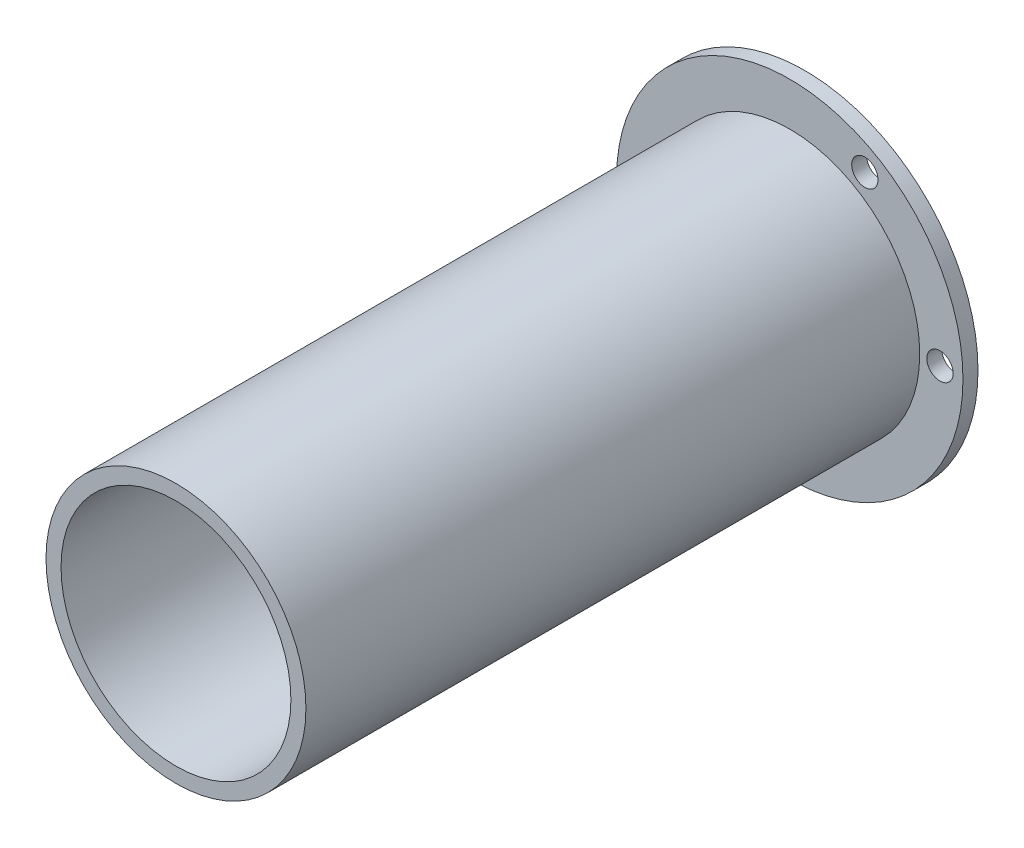
from build123d import *
from build123d.topology import SkipClean

# Parameters (mm, degrees)
SKETCH1_R           = 8.65
SKETCH1_R_2         = 7.65
BOSS_EXTRUDE1_DEPTH = 40.85
BOSS_EXTRUDE2_START = 1
SKETCH2_R           = 11.53
SKETCH2_R_2         = 7.65
BOSS_EXTRUDE2_DEPTH = 1
CIRPATTERN1_COUNT   = 6


with BuildPart() as part:
    # Sketch1 → Boss-Extrude1 (new body)
    with BuildSketch(Plane.XY):
        Circle(SKETCH1_R)
        Circle(SKETCH1_R_2, mode=Mode.SUBTRACT)
    extrude(amount=BOSS_EXTRUDE1_DEPTH)

    # Sketch2 → Boss-Extrude2 (add)
    with SkipClean():  # the faces are left unmerged after this step: merging them gives an invalid solid
        with BuildSketch(Plane(origin=(0, 0, 0), x_dir=(-1, 0, 0), z_dir=(0, 0, -1)).offset(BOSS_EXTRUDE2_START)):
            Circle(SKETCH2_R)
            Circle(SKETCH2_R_2, mode=Mode.SUBTRACT)
        extrude(amount=-BOSS_EXTRUDE2_DEPTH)

    # Sketch11 → Ø2.0mm Dowel Hole1 (revolve, cut)
    with SkipClean():  # the faces are left unmerged after this step: merging them gives an invalid solid
        with BuildSketch(Plane(origin=(-10, 0, 0), x_dir=(0, -1, 0), z_dir=(1, 0, 0))):
            Polygon((0, 0), (0, 5.525753042), (0.875, 5), (0.875, 0), align=None)
        f_2_0mm_dowel_hole1 = revolve(axis=Axis((-10, 0, 6.35), (0, 0, -1)), mode=Mode.SUBTRACT)

    # CirPattern1: Ø2.0mm Dowel Hole1 ×6 about axis, 2 skipped
    with SkipClean():  # the faces are left unmerged after this step: merging them gives an invalid solid
        cirpattern1_axis = Axis((0, 0, 0), (0, 0, -1))
        add([f_2_0mm_dowel_hole1.rotate(cirpattern1_axis, i * 360 / CIRPATTERN1_COUNT) for i in range(1, CIRPATTERN1_COUNT) if i not in (1, 4)], mode=Mode.SUBTRACT)


solid = part.part
